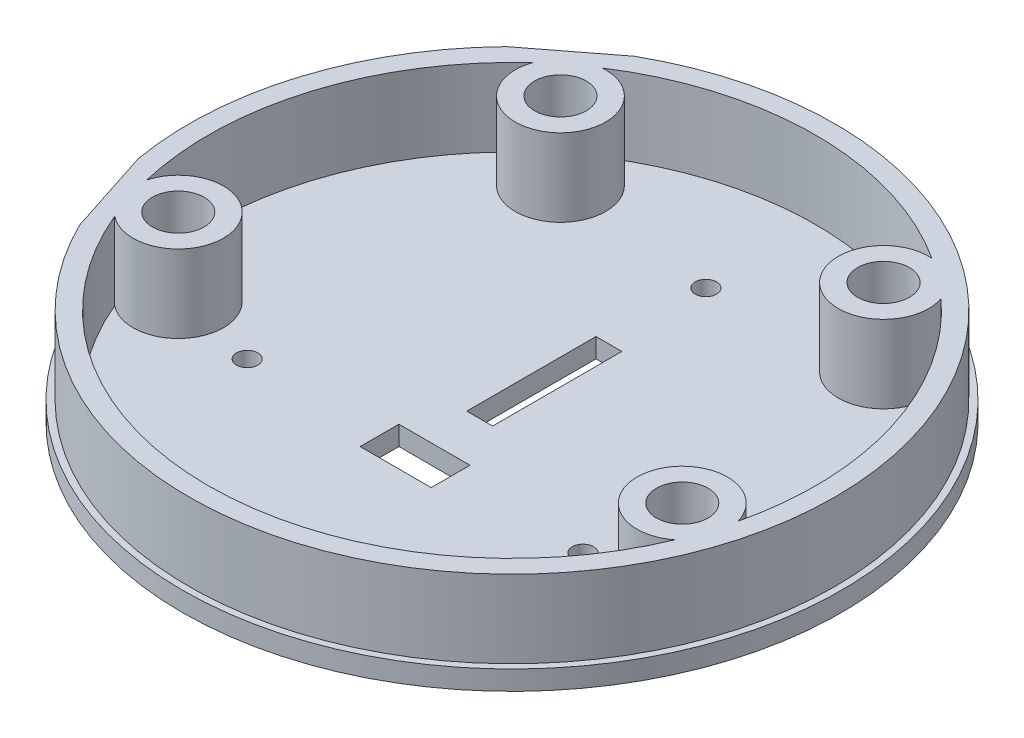
from build123d import *

# Parameters (mm, degrees)
SKETCH_1_R               = 51
EXTRUDE_1_DEPTH          = 3
SKETCH_2_R               = 50
SKETCH_2_R_2             = 47
EXTRUDE_2_DEPTH          = 12
SKETCH_5_R               = 1.65
CUT_EXTRUDE_1_DEPTH      = 10
PATTERN_CIRCULAR_1_COUNT = 3
SKETCH_6_W               = 4
SKETCH_6_H               = 20
SKETCH_6_W_2             = 11
SKETCH_6_H_2             = 6
CUT_EXTRUDE_2_DEPTH      = 10
SKETCH_7_R               = 7
SKETCH_7_R_2             = 4
EXTRUDE_3_DEPTH          = 12
CUT_EXTRUDE_START        = -12
CUT_EXTRUDE_3_DEPTH      = 12


with BuildPart() as part:
    # Эскиз1 → Бобышка-Вытянуть1 (new body)
    with BuildSketch(Plane(origin=(0, 0, 0), x_dir=(1, 0, 0), z_dir=(0, 1, 0))):
        Circle(SKETCH_1_R)
    extrude(amount=EXTRUDE_1_DEPTH)

    # Эскиз2 → Бобышка-Вытянуть2 (add)
    with BuildSketch(Plane(origin=(0, 3, 0), x_dir=(1, 0, 0), z_dir=(0, 1, 0))):
        Circle(SKETCH_2_R)
        Circle(SKETCH_2_R_2, mode=Mode.SUBTRACT)
    extrude(amount=EXTRUDE_2_DEPTH)

    # Эскиз5 → Вырез-Вытянуть1 (cut)
    with BuildSketch(Plane(origin=(0, 3, 0), x_dir=(1, 0, 0), z_dir=(0, 1, 0))):
        with Locations((0, 30)):
            Circle(SKETCH_5_R)
    cut_extrude_1 = extrude(amount=-CUT_EXTRUDE_1_DEPTH, mode=Mode.SUBTRACT)

    # Круговой массив1: Вырез-Вытянуть1 ×3 about axis
    pattern_circular_1_axis = Axis((0, 15, 0), (0, -1, 0))
    for i in range(1, PATTERN_CIRCULAR_1_COUNT):
        add(cut_extrude_1.rotate(pattern_circular_1_axis, i * 360 / PATTERN_CIRCULAR_1_COUNT), mode=Mode.SUBTRACT)

    # Эскиз6 → Вырез-Вытянуть2 (cut)
    with BuildSketch(Plane(origin=(0, 3, 0), x_dir=(1, 0, 0), z_dir=(0, 1, 0))):
        with Locations((0, 5)):
            Rectangle(SKETCH_6_W, SKETCH_6_H)
        with Locations((0, -15)):
            Rectangle(SKETCH_6_W_2, SKETCH_6_H_2)
    extrude(amount=-CUT_EXTRUDE_2_DEPTH, mode=Mode.SUBTRACT)

    # Эскиз7 → Бобышка-Вытянуть3 (add)
    # profile 1 of 4: a face of its own
    with BuildSketch(Plane(origin=(0, 3, 0), x_dir=(1, 0, 0), z_dir=(0, 1, 0))):
        with Locations((-39, -12.649110641)):
            Circle(SKETCH_7_R)
        with Locations((-39, -12.649110641)):
            Circle(SKETCH_7_R_2, mode=Mode.SUBTRACT)
    # profile 2 of 4: a face of its own
    with BuildSketch(Plane(origin=(0, 3, 0), x_dir=(1, 0, 0), z_dir=(0, 1, 0))):
        with Locations((39, -12.649110641)):
            Circle(SKETCH_7_R)
        with Locations((39, -12.649110641)):
            Circle(SKETCH_7_R_2, mode=Mode.SUBTRACT)
    # profile 3 of 4: a face of its own
    with BuildSketch(Plane(origin=(0, 3, 0), x_dir=(1, 0, 0), z_dir=(0, 1, 0))):
        with Locations((-25, 32.496153619)):
            Circle(SKETCH_7_R)
        with Locations((-25, 32.496153619)):
            Circle(SKETCH_7_R_2, mode=Mode.SUBTRACT)
    # profile 4 of 4: a face of its own
    with BuildSketch(Plane(origin=(0, 3, 0), x_dir=(1, 0, 0), z_dir=(0, 1, 0))):
        with Locations((25, 32.496153619)):
            Circle(SKETCH_7_R)
        with Locations((25, 32.496153619)):
            Circle(SKETCH_7_R_2, mode=Mode.SUBTRACT)
    extrude(amount=EXTRUDE_3_DEPTH)

    # Эскиз8 → Вырез-Вытянуть3 (cut)
    with BuildSketch(Plane(origin=(0, 15, 0), x_dir=(1, 0, 0), z_dir=(0, 1, 0)).offset(CUT_EXTRUDE_START)):
        with BuildLine():
            Line((-49.261434929, -8.562185978), (-44.909296778, -21.980788496))
            ThreePointArc((-44.909296778, -21.980788496), (-47.56097561, -15.425744684), (-49.261434929, -8.562185978))
        make_face()
        with BuildLine():
            Line((-35.773349506, 34.932326936), (-24.592504153, 43.533995216))
            ThreePointArc((-24.592504153, 43.533995216), (-30.487804878, 39.629455632), (-35.773349506, 34.932326936))
        make_face()
    extrude(amount=CUT_EXTRUDE_3_DEPTH, mode=Mode.SUBTRACT)


solid = part.part
